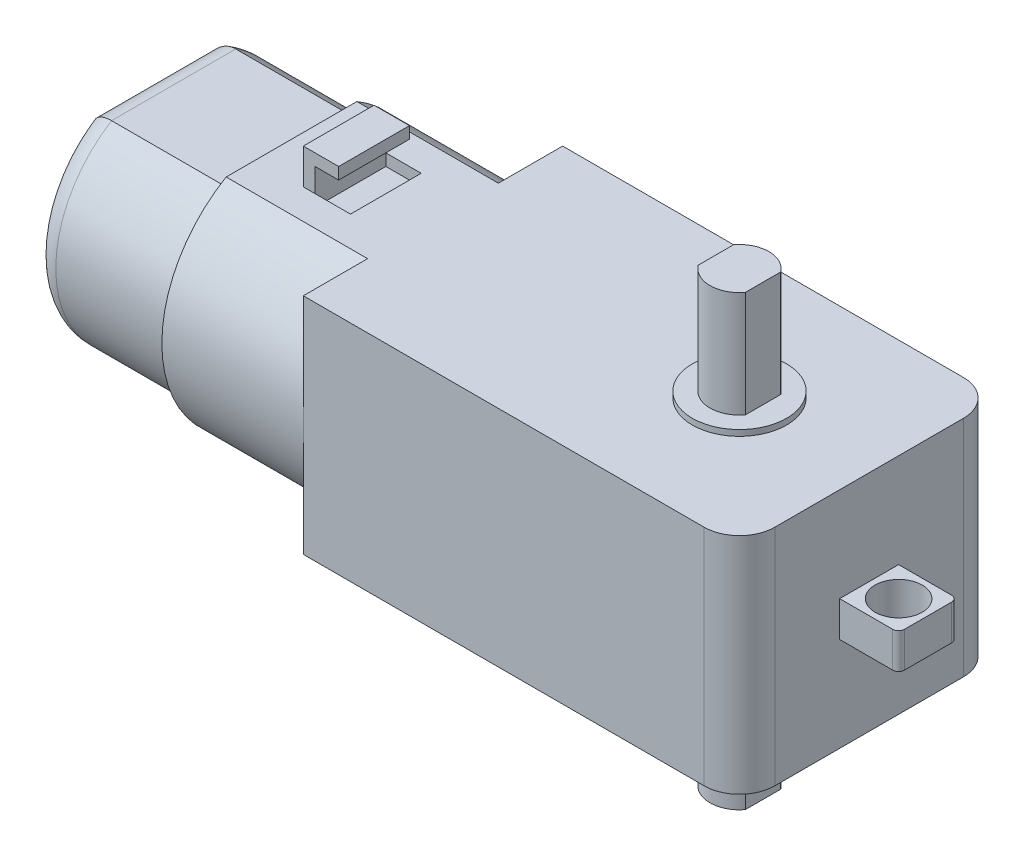
from build123d import *

# Parameters (mm, degrees)
Y_KSEKLIK_EKSTR_ZYON1_DEPTH      = 9.5
Y_KSEKLIK_EKSTR_ZYON1_DEPTH_BACK = 9.5
IZIM7_R                          = 2.5
KES_EKSTR_ZYON2_DEPTH            = 19
Y_KSEKLIK_EKSTR_ZYON7_START      = 0.5
IZIM8_R                          = 4
IZIM8_R_2                        = 2.5
Y_KSEKLIK_EKSTR_ZYON7_DEPTH      = 0.5
IZIM9_R                          = 4
IZIM9_R_2                        = 2.5
Y_KSEKLIK_EKSTR_ZYON8_DEPTH      = 0.5
Y_KSEKLIK_EKSTR_ZYON9_DEPTH      = 19
Y_KSEKLIK_EKSTR_ZYON9_DEPTH_BACK = 19
IZIM10_R                         = 2.5
KES_EKSTR_ZYON4_DEPTH            = 9
KES_EKSTR_ZYON5_DEPTH            = 9
IZIM13_W                         = 5
IZIM13_H                         = 3
Y_KSEKLIK_EKSTR_ZYON10_DEPTH     = 5
IZIM14_R                         = 2
KES_EKSTR_ZYON6_DEPTH            = 5
RADYUS3_R                        = 0.5
Y_KSEKLIK_EKSTR_ZYON11_DEPTH     = 12
Y_KSEKLIK_EKSTR_ZYON12_DEPTH     = 19
Y_KSEKLIK_EKSTR_ZYON13_DEPTH     = 5
RADYUS4_R                        = 2
IZIM18_R                         = 5
Y_KSEKLIK_EKSTR_ZYON14_DEPTH     = 2
RADYUS5_R                        = 1
IZIM19_R                         = 0.5
Y_KSEKLIK_EKSTR_ZYON15_DEPTH     = 2
IZIM20_W                         = 3
IZIM20_H                         = 6
KES_EKSTR_ZYON7_DEPTH            = 1
IZIM21_W                         = 3
IZIM21_H                         = 6
KES_EKSTR_ZYON8_DEPTH            = 1
IZIM22_W                         = 1
IZIM22_H                         = 6
Y_KSEKLIK_EKSTR_ZYON17_DEPTH     = 3
IZIM23_W                         = 6
IZIM23_H                         = 1
Y_KSEKLIK_EKSTR_ZYON18_DEPTH     = 2
IZIM24_W                         = 1
IZIM24_H                         = 6
Y_KSEKLIK_EKSTR_ZYON19_DEPTH     = 3
IZIM25_W                         = 6
IZIM25_H                         = 1
Y_KSEKLIK_EKSTR_ZYON20_DEPTH     = 2


with BuildPart() as part:
    # Çizim1 → Yükseklik-Ekstrüzyon1 (new, two sides: drawn at the far end of the back side and taken through both)
    with BuildSketch(Plane(origin=(0, 0, 0), x_dir=(1, 0, 0), z_dir=(0, 1, 0)).offset(-Y_KSEKLIK_EKSTR_ZYON1_DEPTH_BACK)):
        with BuildLine():
            Line((-18.5, 11), (15.5, 11))
            ThreePointArc((15.5, 11), (17.621320344, 10.121320344), (18.5, 8))
            Line((18.5, 8), (18.5, -8))
            ThreePointArc((18.5, -8), (17.621320344, -10.121320344), (15.5, -11))
            Line((15.5, -11), (-18.5, -11))
            Line((-18.5, -11), (-18.5, 11))
        make_face()
    extrude(amount=Y_KSEKLIK_EKSTR_ZYON1_DEPTH + Y_KSEKLIK_EKSTR_ZYON1_DEPTH_BACK)

    # Çizim7 → Kes-Ekstrüzyon2 (cut)
    with BuildSketch(Plane(origin=(0, 9.5, 0), x_dir=(1, 0, 0), z_dir=(0, 1, 0))):
        with Locations(Location((7.5, 0, 0), (0, 0, 270))):
            Circle(IZIM7_R)
    extrude(amount=-KES_EKSTR_ZYON2_DEPTH, mode=Mode.SUBTRACT)

    # Çizim8 → Yükseklik-Ekstrüzyon7 (add)
    with BuildSketch(Plane(origin=(0, 9.5, 0), x_dir=(1, 0, 0), z_dir=(0, 1, 0)).offset(Y_KSEKLIK_EKSTR_ZYON7_START)):
        with Locations(Location((7.5, 0, 0), (0, 0, 270))):
            Circle(IZIM8_R)
        with Locations(Location((7.5, 0, 0), (0, 0, 270))):
            Circle(IZIM8_R_2, mode=Mode.SUBTRACT)
    extrude(amount=-Y_KSEKLIK_EKSTR_ZYON7_DEPTH)

    # Çizim9 → Yükseklik-Ekstrüzyon8 (add)
    with BuildSketch(Plane.XZ.offset(9.5)):
        with Locations(Location((7.5, 0, 0), (0, 0, 90))):
            Circle(IZIM9_R)
        with Locations(Location((7.5, 0, 0), (0, 0, 90))):
            Circle(IZIM9_R_2, mode=Mode.SUBTRACT)
    extrude(amount=Y_KSEKLIK_EKSTR_ZYON8_DEPTH)

    # Çizim10 → Yükseklik-Ekstrüzyon9 (add, two sides: drawn at the far end of the back side and taken through both)
    with BuildSketch(Plane(origin=(0, 0, 0), x_dir=(1, 0, 0), z_dir=(0, 1, 0)).offset(-Y_KSEKLIK_EKSTR_ZYON9_DEPTH_BACK)):
        with Locations(Location((7.5, 0, 0), (0, 0, 270))):
            Circle(IZIM10_R)
    extrude(amount=Y_KSEKLIK_EKSTR_ZYON9_DEPTH + Y_KSEKLIK_EKSTR_ZYON9_DEPTH_BACK)

    # Çizim11 → Kes-Ekstrüzyon4 (cut)
    with BuildSketch(Plane(origin=(0, 19, 0), x_dir=(1, 0, 0), z_dir=(0, 1, 0))):
        with BuildLine():
            Line((5.5, 1.5), (5.5, -1.5))
            ThreePointArc((5.5, -1.5), (5, 0), (5.5, 1.5))
        make_face()
        with BuildLine():
            Line((9.5, 1.5), (9.5, -1.5))
            ThreePointArc((9.5, -1.5), (10, 0), (9.5, 1.5))
        make_face()
    extrude(amount=-KES_EKSTR_ZYON4_DEPTH, mode=Mode.SUBTRACT)

    # Çizim12 → Kes-Ekstrüzyon5 (cut)
    with BuildSketch(Plane.XZ.offset(19)):
        with BuildLine():
            Line((5.5, 1.5), (5.5, -1.5))
            ThreePointArc((5.5, -1.5), (5, 0), (5.5, 1.5))
        make_face()
        with BuildLine():
            Line((9.5, 1.5), (9.5, -1.5))
            ThreePointArc((9.5, -1.5), (10, 0), (9.5, 1.5))
        make_face()
    extrude(amount=-KES_EKSTR_ZYON5_DEPTH, mode=Mode.SUBTRACT)

    # Çizim13 → Yükseklik-Ekstrüzyon10 (add)
    with BuildSketch(Plane(origin=(18.5, 0, 0), x_dir=(0, 0, -1), z_dir=(1, 0, 0))):
        Rectangle(IZIM13_W, IZIM13_H)
    extrude(amount=Y_KSEKLIK_EKSTR_ZYON10_DEPTH)

    # Çizim14 → Kes-Ekstrüzyon6 (cut)
    with BuildSketch(Plane.XZ.offset(1.5)):
        with Locations(Location((21, 0, 0), (0, 0, 270))):
            Circle(IZIM14_R)
    extrude(amount=-KES_EKSTR_ZYON6_DEPTH, mode=Mode.SUBTRACT)

    # Radyus3
    radyus3_edges = [part.edges().sort_by_distance(p)[0] for p in [
        (23.5, 0, -2.5),
        (23.5, 0, 2.5),
    ]]
    fillet(radyus3_edges, radius=RADYUS3_R)

    # Çizim15 → Yükseklik-Ekstrüzyon11 (add)
    with BuildSketch(Plane.ZY.offset(18.5)):
        with BuildLine():
            Line((5.545268253, 9.5), (-5.545268253, 9.5))
            ThreePointArc((-5.545268253, 9.5), (-11, 0), (-5.545268253, -9.5))
            Line((-5.545268253, -9.5), (5.545268253, -9.5))
            ThreePointArc((5.545268253, -9.5), (10.965120348, -0.875291809), (6.982120022, 8.5))
            ThreePointArc((6.982120022, 8.5), (6.283618722, 9.028628675), (5.545268253, 9.5))
        make_face()
        with BuildLine():
            ThreePointArc((-5.267826876, -8.5), (-10, 0), (-5.267826876, 8.5))
            Line((-5.267826876, 8.5), (5.267826876, 8.5))
            ThreePointArc((5.267826876, 8.5), (10, 0), (5.267826876, -8.5))
            Line((5.267826876, -8.5), (-5.267826876, -8.5))
        make_face(mode=Mode.SUBTRACT)
    extrude(amount=Y_KSEKLIK_EKSTR_ZYON11_DEPTH)

    # Çizim16 → Yükseklik-Ekstrüzyon12 (add)
    with BuildSketch(Plane.ZY.offset(18.5)):
        with BuildLine():
            Line((-5.267826876, 8.5), (5.267826876, 8.5))
            ThreePointArc((5.267826876, 8.5), (10, 0), (5.267826876, -8.5))
            Line((5.267826876, -8.5), (-5.267826876, -8.5))
            ThreePointArc((-5.267826876, -8.5), (-10, 0), (-5.267826876, 8.5))
        make_face()
    extrude(amount=Y_KSEKLIK_EKSTR_ZYON12_DEPTH)

    # Çizim17 → Yükseklik-Ekstrüzyon13 (add)
    with BuildSketch(Plane.ZY.offset(37.5)):
        with BuildLine():
            Line((-5.267826876, 8.5), (5.267826876, 8.5))
            ThreePointArc((5.267826876, 8.5), (10, 0), (5.267826876, -8.5))
            Line((5.267826876, -8.5), (-5.267826876, -8.5))
            ThreePointArc((-5.267826876, -8.5), (-10, 0), (-5.267826876, 8.5))
        make_face()
    extrude(amount=Y_KSEKLIK_EKSTR_ZYON13_DEPTH)

    # Radyus4
    # the kernel refuses this fillet: 2 mm, written as the material it takes off along each edge
    with BuildSketch(Plane(origin=(-42.5, 0, 0), x_dir=(0, -0.9985166114955222, -0.05444792528187306), z_dir=(0, -0.05444792528187306, 0.9985166114955222))) as radyus4_piece_1:
        with BuildLine():
            CenterArc((10 - RADYUS4_R, RADYUS4_R), RADYUS4_R, 270, 90)
            Line((10, RADYUS4_R), (10, 0))
            Line((10, 0), (10 - RADYUS4_R, 0))
        make_face()
    revolve(axis=Axis((-42.5, 0, 0), (1, 0, 0)), revolution_arc=173.757640436, mode=Mode.SUBTRACT)
    with BuildSketch(Plane(origin=(-42.5, -8.5, 10.267826876), x_dir=(1, 0, 0), z_dir=(0, 0, -1))) as radyus4_piece_2:
        with BuildLine():
            CenterArc((RADYUS4_R, -RADYUS4_R), RADYUS4_R, 90, 90)
            Line((0, -RADYUS4_R), (0, 0))
            Line((0, 0), (RADYUS4_R, 0))
        make_face()
    extrude(amount=20.535653753, mode=Mode.SUBTRACT)
    with BuildSketch(Plane(origin=(-42.5, 0, 0), x_dir=(0, 0.9985166114955222, 0.05444792528187289), z_dir=(0, 0.05444792528187289, -0.9985166114955222))) as radyus4_piece_3:
        with BuildLine():
            CenterArc((10 - RADYUS4_R, RADYUS4_R), RADYUS4_R, 270, 90)
            Line((10, RADYUS4_R), (10, 0))
            Line((10, 0), (10 - RADYUS4_R, 0))
        make_face()
    revolve(axis=Axis((-42.5, 0, 0), (1, 0, 0)), revolution_arc=173.757640436, mode=Mode.SUBTRACT)
    with BuildSketch(Plane(origin=(-42.5, 8.5, -10.267826876), x_dir=(0, -1, 0), z_dir=(0, 0, 1))) as radyus4_piece_4:
        with BuildLine():
            CenterArc((RADYUS4_R, RADYUS4_R), RADYUS4_R, 180, 90)
            Line((0, RADYUS4_R), (0, 0))
            Line((0, 0), (RADYUS4_R, 0))
        make_face()
    extrude(amount=20.535653753, mode=Mode.SUBTRACT)

    # Çizim18 → Yükseklik-Ekstrüzyon14 (add)
    with BuildSketch(Plane.ZY.offset(42.5)):
        Circle(IZIM18_R)
    extrude(amount=Y_KSEKLIK_EKSTR_ZYON14_DEPTH)

    # Radyus5
    radyus5_edges = [part.edges().sort_by_distance(p)[0] for p in [
        (-44.5, 0, -5),
    ]]
    fillet(radyus5_edges, radius=RADYUS5_R)

    # Çizim19 → Yükseklik-Ekstrüzyon15 (add)
    with BuildSketch(Plane.ZY.offset(44.5)):
        Circle(IZIM19_R)
    extrude(amount=Y_KSEKLIK_EKSTR_ZYON15_DEPTH)

    # Çizim20 → Kes-Ekstrüzyon7 (cut)
    with BuildSketch(Plane(origin=(0, 9.5, 0), x_dir=(1, 0, 0), z_dir=(0, 1, 0))):
        with Locations((-24, 0)):
            Rectangle(IZIM20_W, IZIM20_H)
    extrude(amount=-KES_EKSTR_ZYON7_DEPTH, mode=Mode.SUBTRACT)

    # Çizim21 → Kes-Ekstrüzyon8 (cut)
    with BuildSketch(Plane.XZ.offset(9.5)):
        with Locations((-24, 0)):
            Rectangle(IZIM21_W, IZIM21_H)
    extrude(amount=-KES_EKSTR_ZYON8_DEPTH, mode=Mode.SUBTRACT)

    # Çizim22 → Yükseklik-Ekstrüzyon17 (add)
    with BuildSketch(Plane.XZ.offset(9.5)):
        with Locations((-26, 0)):
            Rectangle(IZIM22_W, IZIM22_H)
    extrude(amount=Y_KSEKLIK_EKSTR_ZYON17_DEPTH)

    # Çizim23 → Yükseklik-Ekstrüzyon18 (add)
    with BuildSketch(Plane(origin=(-25.5, 0, 0), x_dir=(0, 0, -1), z_dir=(1, 0, 0))):
        with Locations((0, -12)):
            Rectangle(IZIM23_W, IZIM23_H)
    extrude(amount=Y_KSEKLIK_EKSTR_ZYON18_DEPTH)

    # Çizim24 → Yükseklik-Ekstrüzyon19 (add)
    with BuildSketch(Plane(origin=(0, 9.5, 0), x_dir=(1, 0, 0), z_dir=(0, 1, 0))):
        with Locations((-26, 0)):
            Rectangle(IZIM24_W, IZIM24_H)
    extrude(amount=Y_KSEKLIK_EKSTR_ZYON19_DEPTH)

    # Çizim25 → Yükseklik-Ekstrüzyon20 (add)
    with BuildSketch(Plane(origin=(-25.5, 0, 0), x_dir=(0, 0, -1), z_dir=(1, 0, 0))):
        with Locations((0, 12)):
            Rectangle(IZIM25_W, IZIM25_H)
    extrude(amount=Y_KSEKLIK_EKSTR_ZYON20_DEPTH)


solid = part.part
